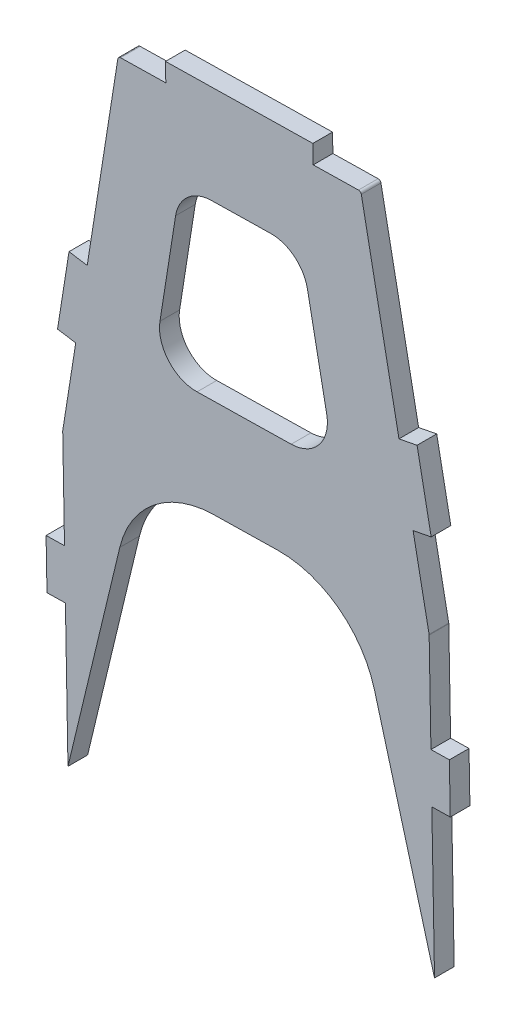
from build123d import *

# Parameters (mm, degrees)
BOSS_EXTRUDE2_DEPTH = 5.08
FILLET2_R           = 9.525
FILLET3_R           = 25.4


with BuildPart() as part:
    # Sketch5 → Boss-Extrude2 (new body)
    with BuildSketch(Plane(origin=(0, 0, -50.8), x_dir=(-1, 0, 0), z_dir=(0, 0, -1))):
        with BuildLine():
            Line((-52.084134713, -74.90469108), (-56.217901117, -96.079564574))
            ThreePointArc((-56.217901117, -96.079564574), (-56.227450796, -96.143111106), (-56.231425689, -96.207248133))
            Line((-56.231425689, -96.207248133), (-56.695270711, -121.603012501))
            Line((-56.695270711, -121.603012501), (-61.45697653, -121.516041559))
            Line((-61.45697653, -121.516041559), (-61.688899041, -134.213923743))
            Line((-61.688899041, -134.213923743), (-56.927193222, -134.300894684))
            Line((-56.927193222, -134.300894684), (-57.620624926, -172.266653317))
            Line((-57.620624926, -172.266653317), (-36.877249891, -96.432815008))
            Line((-36.877249891, -96.432815008), (19.109812826, -97.455399718))
            Line((19.109812826, -97.455399718), (37.101706355, -172.266653317))
            Line((37.101706355, -172.266653317), (37.763549432, -136.03038898))
            Line((37.763549432, -136.03038898), (42.525255251, -136.117359921))
            Line((42.525255251, -136.117359921), (42.757177762, -123.419477738))
            Line((42.757177762, -123.419477738), (37.995471943, -123.332506796))
            Line((37.995471943, -123.332506796), (38.459316965, -97.936742429))
            ThreePointArc((38.459316965, -97.936742429), (38.457686823, -97.872503028), (38.450464051, -97.808650153))
            Line((38.450464051, -97.808650153), (35.09270057, -76.496946406))
            Line((35.09270057, -76.496946406), (39.797167723, -75.755734526))
            Line((39.797167723, -75.755734526), (36.832320201, -56.937865912))
            Line((36.832320201, -56.937865912), (32.127853048, -57.679077792))
            Line((32.127853048, -57.679077792), (24.22159299, -7.498094822))
            ThreePointArc((24.22159299, -7.498094822), (23.977671585, -7.057207813), (23.507420242, -6.876258426))
            Line((23.507420242, -6.876258426), (11.818416858, -6.662762744))
            Line((11.818416858, -6.662762744), (11.905387799, -1.901056925))
            Line((11.905387799, -1.901056925), (-26.188258752, -1.205289392))
            Line((-26.188258752, -1.205289392), (-26.275229693, -5.966995211))
            Line((-26.275229693, -5.966995211), (-37.964233078, -5.753499529))
            ThreePointArc((-37.964233078, -5.753499529), (-38.44077853, -5.917155993), (-38.700637178, -6.348841631))
            Line((-38.700637178, -6.348841631), (-48.434089931, -56.20764123))
            Line((-48.434089931, -56.20764123), (-53.108352393, -55.295130035))
            Line((-53.108352393, -55.295130035), (-56.758397176, -73.992179884))
            Line((-56.758397176, -73.992179884), (-52.084134713, -74.90469108))
        make_face()
        Polygon((8.046213899, -27.234806762), (15.095699394, -71.977846959), (-31.935446416, -71.118839034), (-23.256774895, -26.66306829), align=None, mode=Mode.SUBTRACT)
    extrude(amount=BOSS_EXTRUDE2_DEPTH)

    # Fillet2
    fillet2_edges = [part.edges().sort_by_distance(p)[0] for p in [
        (23.256774895, -26.66306829, -53.34),
        (-8.046213899, -27.234806762, -53.34),
        (31.935446416, -71.118839034, -53.34),
        (-15.095699394, -71.977846959, -53.34),
    ]]
    fillet(fillet2_edges, radius=FILLET2_R)

    # Fillet3
    fillet3_edges = [part.edges().sort_by_distance(p)[0] for p in [
        (-19.109812826, -97.455399718, -53.34),
        (36.877249891, -96.432815008, -53.34),
    ]]
    fillet(fillet3_edges, radius=FILLET3_R)


solid = part.part
